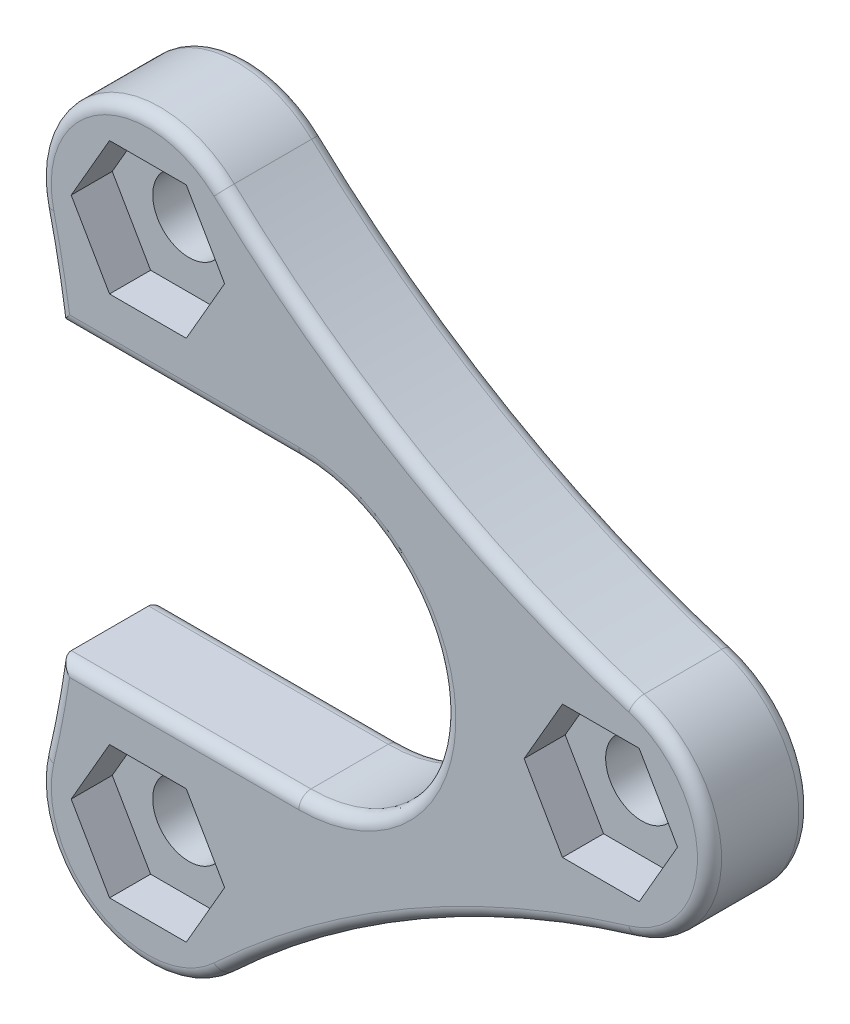
from build123d import *

# Parameters (mm, degrees)
SKETCH3_R            = 1.5
BOSS_BODY_DEPTH      = 2.5
BOSS_EXTRABODY_DEPTH = 1.7
FILLET_SINGLE_R      = 0.5


with BuildPart() as part:
    # Sketch3 → Boss-Body (new body)
    with BuildSketch(Plane.XY):
        with BuildLine():
            Line((0, 6), (-9.920662288, 6))
            ThreePointArc((-9.920662288, 6), (-10.233399282, 7.907873526), (-10.631578947, 9.799761148))
            ThreePointArc((-10.631578947, 9.799761148), (-8.5, 14.722431864), (-3.171052632, 14.107098025))
            ThreePointArc((-3.171052632, 14.107098025), (4.75, 8.227241336), (13.802631579, 4.307336877))
            ThreePointArc((13.802631579, 4.307336877), (17, 0), (13.802631579, -4.307336877))
            ThreePointArc((13.802631579, -4.307336877), (4.75, -8.227241336), (-3.171052632, -14.107098025))
            ThreePointArc((-3.171052632, -14.107098025), (-8.5, -14.722431864), (-10.631578947, -9.799761148))
            ThreePointArc((-10.631578947, -9.799761148), (-10.233399282, -7.907873526), (-9.920662288, -6))
            Line((-9.920662288, -6), (0, -6))
            ThreePointArc((0, -6), (6, 0), (0, 6))
        make_face()
        with Locations((-6.25, 10.825317547)):
            Circle(SKETCH3_R, mode=Mode.SUBTRACT)
        with Locations((12.5, 0)):
            Circle(SKETCH3_R, mode=Mode.SUBTRACT)
        with Locations((-6.25, -10.825317547)):
            Circle(SKETCH3_R, mode=Mode.SUBTRACT)
    extrude(amount=BOSS_BODY_DEPTH)

    # Sketch4 → Boss-ExtraBody (add)
    with BuildSketch(Plane.XY.offset(2.5)):
        with BuildLine():
            Line((0, -6), (-9.920662288, -6))
            ThreePointArc((-9.920662288, -6), (-10.233399282, -7.907873526), (-10.631578947, -9.799761148))
            ThreePointArc((-10.631578947, -9.799761148), (-8.5, -14.722431864), (-3.171052632, -14.107098025))
            ThreePointArc((-3.171052632, -14.107098025), (4.75, -8.227241336), (13.802631579, -4.307336877))
            ThreePointArc((13.802631579, -4.307336877), (17, 0), (13.802631579, 4.307336877))
            ThreePointArc((13.802631579, 4.307336877), (4.75, 8.227241336), (-3.171052632, 14.107098025))
            ThreePointArc((-3.171052632, 14.107098025), (-8.5, 14.722431864), (-10.631578947, 9.799761148))
            ThreePointArc((-10.631578947, 9.799761148), (-10.233399282, 7.907873526), (-9.920662288, 6))
            Line((-9.920662288, 6), (0, 6))
            ThreePointArc((0, 6), (6, 0), (0, -6))
        make_face()
        Polygon((-4.66228676, 13.575317547), (-7.83771324, 13.575317547), (-9.425426481, 10.825317547), (-7.83771324, 8.075317547), (-4.66228676, 8.075317547), (-3.074573519, 10.825317547), align=None, mode=Mode.SUBTRACT)
        Polygon((10.91228676, -2.75), (14.08771324, -2.75), (15.675426481, 0), (14.08771324, 2.75), (10.91228676, 2.75), (9.324573519, 0), align=None, mode=Mode.SUBTRACT)
        Polygon((-7.83771324, -13.575317547), (-4.66228676, -13.575317547), (-3.074573519, -10.825317547), (-4.66228676, -8.075317547), (-7.83771324, -8.075317547), (-9.425426481, -10.825317547), align=None, mode=Mode.SUBTRACT)
    extrude(amount=BOSS_EXTRABODY_DEPTH)

    # Fillet-Single
    fillet_single_edges = [part.edges().sort_by_distance(p)[0] for p in [
        (-4.960331144, 6, 0),
        (-4.960331144, -6, 0),
        (-4.960331144, 6, 4.2),
        (-4.960331144, -6, 4.2),
        (-10.233399282, -7.907873526, 0),
        (-8.5, -14.722431864, 0),
        (-10.233399282, 7.907873526, 0),
        (-8.5, 14.722431864, 0),
        (4.75, 8.227241336, 0),
        (17, 0, 0),
        (-10.233399282, -7.907873526, 4.2),
        (-8.5, -14.722431864, 4.2),
        (-10.233399282, 7.907873526, 4.2),
        (-8.5, 14.722431864, 4.2),
        (4.75, 8.227241336, 4.2),
        (17, 0, 4.2),
        (6, 0, 0),
        (6, 0, 4.2),
        (4.75, -8.227241336, 0),
        (4.75, -8.227241336, 4.2),
    ]]
    fillet(fillet_single_edges, radius=FILLET_SINGLE_R)


solid = part.part
